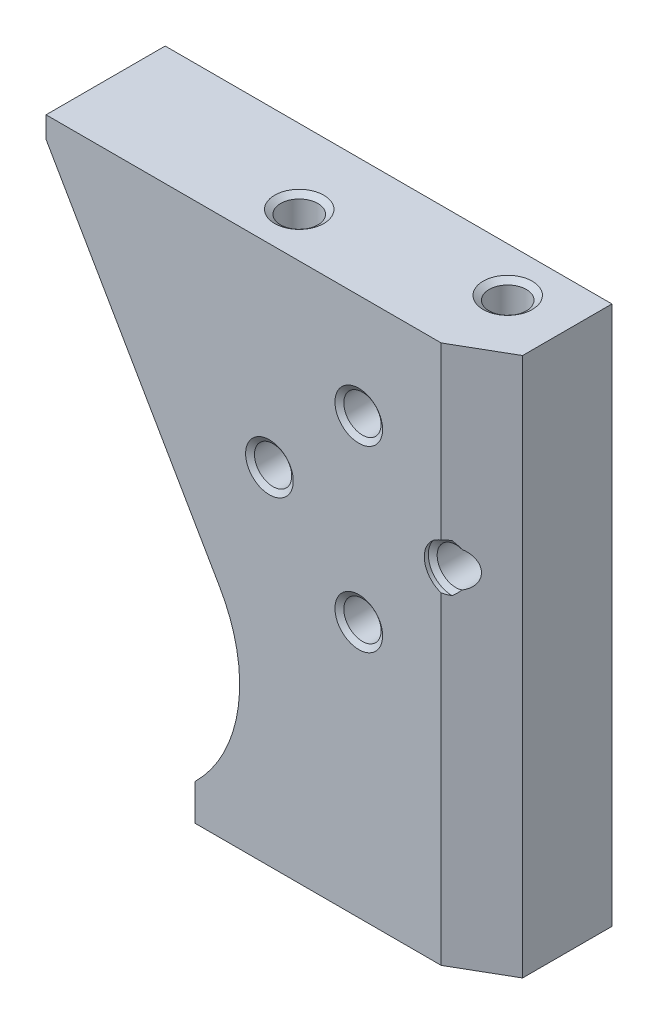
from build123d import *

# Parameters (mm, degrees)
SKETCH_1_W                  = 30
SKETCH_1_H                  = 36.2
EXTRUDE_1_DEPTH             = 8
CUT_EXTRUDE_1_DEPTH         = 48.691089314
CHAMFER_1_SIZE              = 2
CHAMFER_1_SIZE2             = 3.464101615
HOLE_WIZARD_M31_D           = 2.5
HOLE_WIZARD_M31_DEPTH       = 10.5
HOLE_WIZARD_M31_CSINK_D     = 3.3
HOLE_WIZARD_M31_CSINK_ANGLE = 110
HOLE_WIZARD_M31_TIP         = 0.751075774
HOLE_WIZARD_M32_D           = 2.5
HOLE_WIZARD_M32_DEPTH       = 10
HOLE_WIZARD_M32_CSINK_D     = 3.3
HOLE_WIZARD_M32_CSINK_ANGLE = 110
HOLE_WIZARD_M32_TIP         = 0.751075774


# Read off the part's stored shape, not the designer's step: Отверстие обработанное метчиком M35
with BuildPart() as part:
    # Эскиз1 → Бобышка-Вытянуть1 (new body)
    with BuildSketch(Plane.XY):
        with Locations((15, 18.1)):
            Rectangle(SKETCH_1_W, SKETCH_1_H)
    extrude(amount=EXTRUDE_1_DEPTH)

    # Эскиз2 → Вырез-Вытянуть1 (cut, through all)
    with BuildSketch(Plane(origin=(0, 0, 0), x_dir=(-1, 0, 0), z_dir=(0, 0, -1))):
        with BuildLine():
            Line((50.920424152, 122.962914197), (0, 34.766152423))
            Line((0, 34.766152423), (-11.660254038, 14.57))
            ThreePointArc((-11.660254038, 14.57), (-12.907797949, 8.215179054), (-10, 2.428571571))
            Line((-10, 2.428571571), (-10, 0))
            Line((-10, 0), (-10, -101.840848304))
            Line((-10, -101.840848304), (186.590983298, -155.115784424))
            Line((186.590983298, -155.115784424), (247.51140745, 69.687978076))
            Line((247.51140745, 69.687978076), (50.920424152, 122.962914197))
        make_face()
    extrude(amount=-CUT_EXTRUDE_1_DEPTH, mode=Mode.SUBTRACT)

    # Фаска1
    chamfer_1_edges = [part.edges().sort_by_distance(p)[0] for p in [
        (30, 18.1, 8),
    ]]
    chamfer_1_side = [part.faces().sort_by_distance(p)[0] for p in [
        (30, 18.1, 4),
    ]]
    chamfer(chamfer_1_edges, length=CHAMFER_1_SIZE, length2=CHAMFER_1_SIZE2, reference=chamfer_1_side[0])

    # Отверстие обработанное метчиком M31
    with Locations(Plane.XZ):
        with Locations((24, 5), (15, 5)):
            CounterSinkHole(HOLE_WIZARD_M31_D / 2, HOLE_WIZARD_M31_CSINK_D / 2, depth=HOLE_WIZARD_M31_DEPTH, counter_sink_angle=HOLE_WIZARD_M31_CSINK_ANGLE)
            with Locations((0, 0, -(HOLE_WIZARD_M31_DEPTH + HOLE_WIZARD_M31_TIP / 2))):  # 118° drill point
                Cone(0, HOLE_WIZARD_M31_D / 2, HOLE_WIZARD_M31_TIP, mode=Mode.SUBTRACT)

    # Отверстие обработанное метчиком M32
    with Locations(Plane(origin=(0, 36.2, 0), x_dir=(-1, 0, 0), z_dir=(0, 1, 0))):
        with Locations((-14, 5), (-26, 3)):
            CounterSinkHole(HOLE_WIZARD_M32_D / 2, HOLE_WIZARD_M32_CSINK_D / 2, depth=HOLE_WIZARD_M32_DEPTH, counter_sink_angle=HOLE_WIZARD_M32_CSINK_ANGLE)
            with Locations((0, 0, -(HOLE_WIZARD_M32_DEPTH + HOLE_WIZARD_M32_TIP / 2))):  # 118° drill point
                Cone(0, HOLE_WIZARD_M32_D / 2, HOLE_WIZARD_M32_TIP, mode=Mode.SUBTRACT)

    # Отверстие обработанное метчиком M35 outline → Отверстие обработанное метчиком M35 (revolve, cut)
    with BuildSketch(Plane(origin=(15, 23.2, 0), x_dir=(1, 0, 0), z_dir=(0, -1, 0))):
        Polygon((1.6, 8), (0, 8), (0, 0), (1.6, 0), (1.25, 0.245072638), (1.25, 7.754927362), align=None)
    revolve(axis=Axis((15, 23.2, 0), (0, 0, 1)), mode=Mode.SUBTRACT)

    # Hole Wizard M35 2 outline → Hole Wizard M35 2 (revolve, cut)
    with BuildSketch(Plane(origin=(27, 23.2, 0), x_dir=(1, 0, 0), z_dir=(0, -1, 0))):
        Polygon((1.6, 8), (0, 8), (0, 0), (1.6, 0), (1.25, 0.245072638), (1.25, 7.486978169), (1.6, 7.732050808), align=None)
    revolve(axis=Axis((27, 23.2, 0), (0, 0, 1)), mode=Mode.SUBTRACT)

    # Hole Wizard M35 3 outline → Hole Wizard M35 3 (revolve, cut)
    with BuildSketch(Plane(origin=(21, 17.2, 0), x_dir=(1, 0, 0), z_dir=(0, -1, 0))):
        Polygon((1.6, 8), (0, 8), (0, 0), (1.6, 0), (1.25, 0.245072638), (1.25, 7.754927362), align=None)
    revolve(axis=Axis((21, 17.2, 0), (0, 0, 1)), mode=Mode.SUBTRACT)

    # Hole Wizard M35 4 outline → Hole Wizard M35 4 (revolve, cut)
    with BuildSketch(Plane(origin=(21, 29.2, 0), x_dir=(1, 0, 0), z_dir=(0, -1, 0))):
        Polygon((1.6, 8), (0, 8), (0, 0), (1.6, 0), (1.25, 0.245072638), (1.25, 7.754927362), align=None)
    revolve(axis=Axis((21, 29.2, 0), (0, 0, 1)), mode=Mode.SUBTRACT)


solid = part.part
